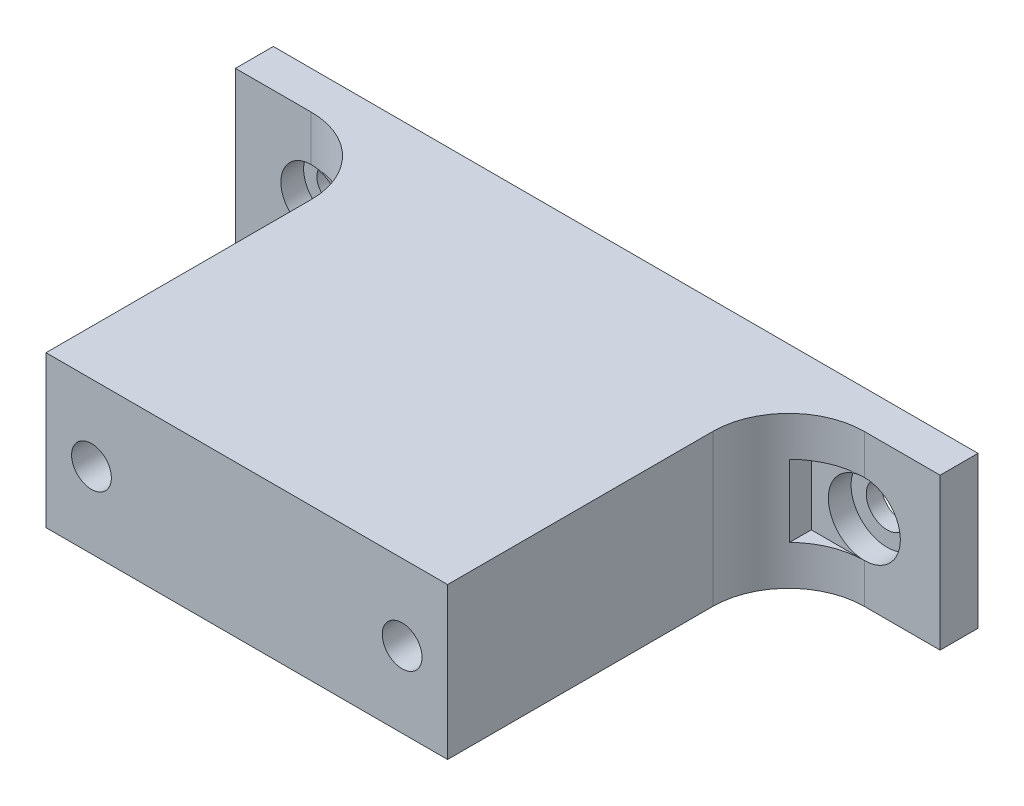
from build123d import *

# Parameters (mm, degrees)
SKETCH_1_W                     = 53
SKETCH_1_H                     = 20
EXTRUDE_1_DEPTH                = 50
HOLE_WIZARD_M5_1_D             = 5.25
HOLE_WIZARD_M5_1_DEPTH         = 15
HOLE_WIZARD_M5_1_TIP           = 1.577259125
SKETCH_4_W                     = 5
SKETCH_4_H                     = 20
EXTRUDE_2_DEPTH                = 20
HOLE_WIZARD_M4_1_D             = 4.5
HOLE_WIZARD_M4_1_DEPTH         = 15
HOLE_WIZARD_M4_1_CBORE_D       = 8
HOLE_WIZARD_M4_1_CBORE_DEPTH   = 3
HOLE_WIZARD_M4_1_TIP           = 1.351936393
SKETCH_7_W                     = 5
SKETCH_7_H                     = 20
EXTRUDE_3_DEPTH                = 20
HOLE_WIZARD_M5_1_2_D           = 5.5
HOLE_WIZARD_M5_1_2_DEPTH       = 15
HOLE_WIZARD_M5_1_2_CBORE_D     = 9.5
HOLE_WIZARD_M5_1_2_CBORE_DEPTH = 3
HOLE_WIZARD_M5_1_2_TIP         = 1.652366702
FILLET_1_R                     = 10
SKETCH_10_W                    = 6
SKETCH_10_H                    = 8
SKETCH_10_W_2                  = 7
SKETCH_10_H_2                  = 9.5
CUT_EXTRUDE_1_DEPTH            = 20


with BuildPart() as part:
    # 스케치1 → 보스-돌출1 (new body)
    with BuildSketch(Plane.XY):
        Rectangle(SKETCH_1_W, SKETCH_1_H)
    extrude(amount=EXTRUDE_1_DEPTH)

    # Hole Wizard M5 _ _1
    with Locations(Plane.XY.offset(50)):
        with Locations((20.5, 0), (-20.5, 0)):
            Hole(HOLE_WIZARD_M5_1_D / 2, depth=HOLE_WIZARD_M5_1_DEPTH)
            with Locations((0, 0, -(HOLE_WIZARD_M5_1_DEPTH + HOLE_WIZARD_M5_1_TIP / 2))):  # 118° drill point
                Cone(0, HOLE_WIZARD_M5_1_D / 2, HOLE_WIZARD_M5_1_TIP, mode=Mode.SUBTRACT)

    # 스케치4 → 보스-돌출2 (add)
    with BuildSketch(Plane.ZY.offset(26.5)):
        with Locations((2.5, 0)):
            Rectangle(SKETCH_4_W, SKETCH_4_H)
    extrude(amount=EXTRUDE_2_DEPTH)

    # M4 소켓 머리 캡 나사용 카운터보어1
    with Locations(Plane.XY.offset(5)):
        with Locations((-36.5, 0)):
            CounterBoreHole(HOLE_WIZARD_M4_1_D / 2, HOLE_WIZARD_M4_1_CBORE_D / 2, HOLE_WIZARD_M4_1_CBORE_DEPTH, depth=HOLE_WIZARD_M4_1_DEPTH)
            with Locations((0, 0, -(HOLE_WIZARD_M4_1_DEPTH + HOLE_WIZARD_M4_1_TIP / 2))):  # 118° drill point
                Cone(0, HOLE_WIZARD_M4_1_D / 2, HOLE_WIZARD_M4_1_TIP, mode=Mode.SUBTRACT)

    # 스케치7 → 보스-돌출3 (add)
    with BuildSketch(Plane(origin=(26.5, 0, 0), x_dir=(0, 0, -1), z_dir=(1, 0, 0))):
        with Locations((-2.5, 0)):
            Rectangle(SKETCH_7_W, SKETCH_7_H)
    extrude(amount=EXTRUDE_3_DEPTH)

    # Hole Wizard M5 _ _ _ _ _1 2
    with Locations(Plane.XY.offset(5)):
        with Locations((36.5, 0)):
            CounterBoreHole(HOLE_WIZARD_M5_1_2_D / 2, HOLE_WIZARD_M5_1_2_CBORE_D / 2, HOLE_WIZARD_M5_1_2_CBORE_DEPTH, depth=HOLE_WIZARD_M5_1_2_DEPTH)
            with Locations((0, 0, -(HOLE_WIZARD_M5_1_2_DEPTH + HOLE_WIZARD_M5_1_2_TIP / 2))):  # 118° drill point
                Cone(0, HOLE_WIZARD_M5_1_2_D / 2, HOLE_WIZARD_M5_1_2_TIP, mode=Mode.SUBTRACT)

    # 필렛1
    # the kernel refuses this fillet: 10 mm, written as the material it adds along each edge
    with BuildSketch(Plane(origin=(-26.5, 10, 5), x_dir=(0, 0, 1), z_dir=(0, -1, 0))) as fillet_1_piece_1_section:
        with BuildLine():
            CenterArc((FILLET_1_R, FILLET_1_R), FILLET_1_R, 180, 90)
            Line((0, FILLET_1_R), (0, 0))
            Line((0, 0), (FILLET_1_R, 0))
        make_face()
    fillet_1_piece_1 = extrude(amount=20, mode=Mode.PRIVATE)
    fillet_1_piece_1 = fillet_1_piece_1 - Plane(origin=(-36.5, 0, 7.308851988), x_dir=(1, 0, 0), z_dir=(0, 0, 1)) * Cylinder(4, 81, mode=Mode.PRIVATE)
    add(fillet_1_piece_1)
    with BuildSketch(Plane(origin=(26.5, 10, 5), x_dir=(0, 0, 1), z_dir=(0, -1, 0))) as fillet_1_piece_2_section:
        with BuildLine():
            CenterArc((FILLET_1_R, -FILLET_1_R), FILLET_1_R, 90, 90)
            Line((0, -FILLET_1_R), (0, 0))
            Line((0, 0), (FILLET_1_R, 0))
        make_face()
    fillet_1_piece_2 = extrude(amount=20, mode=Mode.PRIVATE)
    fillet_1_piece_2 = fillet_1_piece_2 - Plane(origin=(36.5, 0, 7.33913119), x_dir=(1, 0, 0), z_dir=(0, 0, 1)) * Cylinder(4.75, 80, mode=Mode.PRIVATE)
    add(fillet_1_piece_2)

    # 스케치10 → 컷-돌출1 (cut)
    with BuildSketch(Plane.XY.offset(5)):
        with Locations((-33.5, 0)):
            Rectangle(SKETCH_10_W, SKETCH_10_H)
        with Locations((33, 0)):
            Rectangle(SKETCH_10_W_2, SKETCH_10_H_2)
    extrude(amount=CUT_EXTRUDE_1_DEPTH, mode=Mode.SUBTRACT)


solid = part.part
